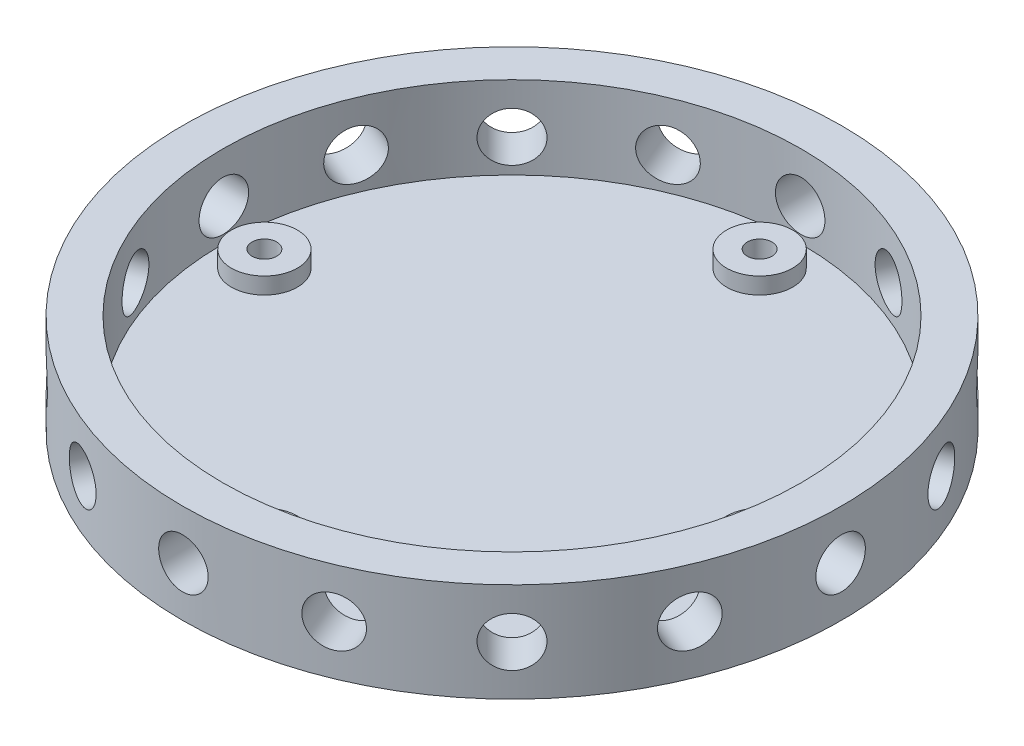
from build123d import *

# Parameters (mm, degrees)
SKETCH1_R           = 63.373
BOSS_EXTRUDE1_DEPTH = 3.175
SKETCH2_R           = 63.373
SKETCH2_R_2         = 55.626
BOSS_EXTRUDE2_DEPTH = 15.875
SKETCH9_R           = 4.7625
CUT_EXTRUDE2_DEPTH  = 92.625197179
CIRPATTERN5_COUNT   = 16
SKETCH4_R           = 6.35
SKETCH4_R_2         = 2.38125
BOSS_EXTRUDE4_DEPTH = 3.175
CIRPATTERN1_COUNT   = 4
SKETCH8_R           = 0.029426367
SKETCH8_R_2         = 2.38125
CUT_EXTRUDE1_DEPTH  = 92.625197338
CIRPATTERN3_COUNT   = 4


with BuildPart() as part:
    # Sketch1 → Boss-Extrude1 (new body)
    with BuildSketch(Plane(origin=(0, 0, 0), x_dir=(1, 0, 0), z_dir=(0, 1, 0))):
        Circle(SKETCH1_R)
    extrude(amount=BOSS_EXTRUDE1_DEPTH)

    # Sketch2 → Boss-Extrude2 (add)
    with BuildSketch(Plane(origin=(0, 3.175, 0), x_dir=(1, 0, 0), z_dir=(0, 1, 0))):
        Circle(SKETCH2_R)
        Circle(SKETCH2_R_2, mode=Mode.SUBTRACT)
    extrude(amount=BOSS_EXTRUDE2_DEPTH)

    # Sketch9 → Cut-Extrude2 (cut, through all)
    with BuildSketch(Plane.XY):
        with Locations((0, 9.525)):
            Circle(SKETCH9_R)
    cut_extrude2 = extrude(amount=-CUT_EXTRUDE2_DEPTH, mode=Mode.SUBTRACT)

    # CirPattern5: Cut-Extrude2 ×16 about axis
    cirpattern5_axis = Axis((0, 19.05, 0), (0, -1, 0))
    for i in range(1, CIRPATTERN5_COUNT):
        add(cut_extrude2.rotate(cirpattern5_axis, i * 360 / CIRPATTERN5_COUNT), mode=Mode.SUBTRACT)

    # Sketch4 → Boss-Extrude4 (add)
    with BuildSketch(Plane(origin=(0, 3.175, 0), x_dir=(1, 0, 0), z_dir=(0, 1, 0))):
        with Locations((-47.625, 0)):
            Circle(SKETCH4_R)
        with Locations((-47.625, 0)):
            Circle(SKETCH4_R_2, mode=Mode.SUBTRACT)
    boss_extrude4 = extrude(amount=BOSS_EXTRUDE4_DEPTH)

    # CirPattern1: Boss-Extrude4 ×4 about axis
    cirpattern1_axis = Axis((0, 19.05, 0), (0, 1, 0))
    for i in range(1, CIRPATTERN1_COUNT):
        add(boss_extrude4.rotate(cirpattern1_axis, i * 360 / CIRPATTERN1_COUNT))

    # Sketch8 → Cut-Extrude1 (cut, through all)
    with BuildSketch(Plane(origin=(0, 19.05, 0), x_dir=(1, 0, 0), z_dir=(0, 1, 0))):
        with Locations((-57.030443775, -0.834327162)):
            Circle(SKETCH8_R)
        with Locations((-47.625, 0)):
            Circle(SKETCH8_R_2)
    cut_extrude1 = extrude(amount=-CUT_EXTRUDE1_DEPTH, mode=Mode.SUBTRACT)

    # CirPattern3: Cut-Extrude1 ×4 about axis
    cirpattern3_axis = Axis((0, 19.05, 0), (0, 1, 0))
    for i in range(1, CIRPATTERN3_COUNT):
        add(cut_extrude1.rotate(cirpattern3_axis, i * 360 / CIRPATTERN3_COUNT), mode=Mode.SUBTRACT)


solid = part.part
